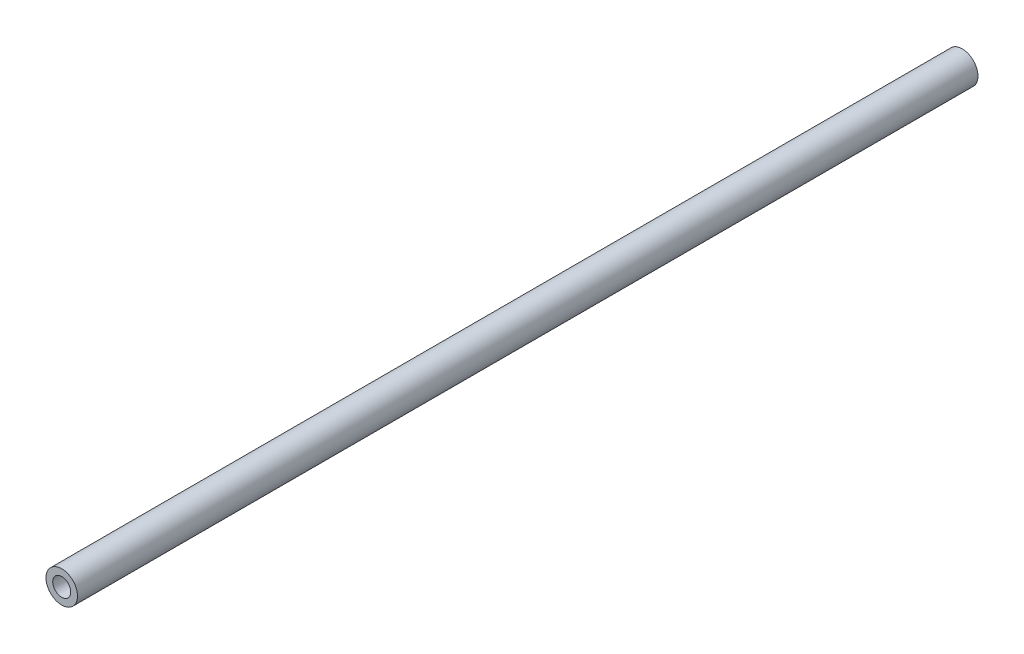
from build123d import *

# Parameters (mm, degrees)
SKETCH1_R           = 3.5
BOSS_EXTRUDE1_DEPTH = 200
SKETCH2_R           = 2
CUT_EXTRUDE1_DEPTH  = 15
CUT_EXTRUDE3_START  = -20
SKETCH4_R           = 2
CUT_EXTRUDE3_DEPTH  = 20


with BuildPart() as part:
    # Sketch1 → Boss-Extrude1 (new body)
    with BuildSketch(Plane.XY):
        Circle(SKETCH1_R)
    extrude(amount=BOSS_EXTRUDE1_DEPTH)

    # Sketch2 → Cut-Extrude1 (cut)
    with BuildSketch(Plane(origin=(0, 0, 0), x_dir=(-1, 0, 0), z_dir=(0, 0, -1))):
        Circle(SKETCH2_R)
    extrude(amount=-CUT_EXTRUDE1_DEPTH, mode=Mode.SUBTRACT)

    # Sketch4 → Cut-Extrude3 (cut)
    with BuildSketch(Plane.XY.offset(200).offset(CUT_EXTRUDE3_START)):
        Circle(SKETCH4_R)
    extrude(amount=CUT_EXTRUDE3_DEPTH, mode=Mode.SUBTRACT)


solid = part.part
